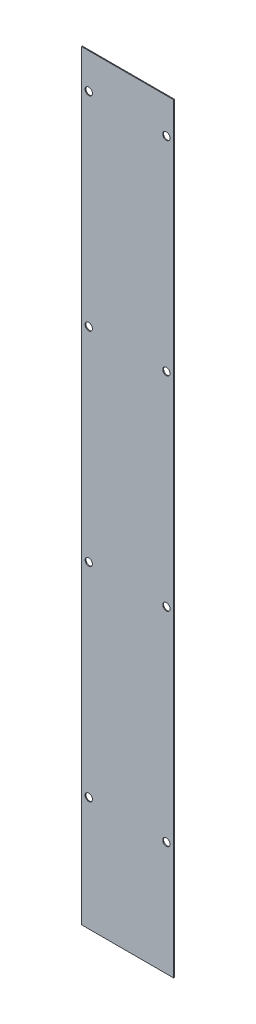
from build123d import *

# Parameters (mm, degrees)
SKETCH1_W          = 76
SKETCH1_H          = 627
BASE_FLANGE1_DEPTH = 0.7
SKETCH2_R          = 3
CUT_EXTRUDE1_DEPTH = 10


# Sheet-metal steps are written as plain solids
with BuildPart() as part:
    # Sketch1 → Base-Flange1 (new body)
    with BuildSketch(Plane.XY):
        with Locations((38, 313.5)):
            Rectangle(SKETCH1_W, SKETCH1_H)
    extrude(amount=-BASE_FLANGE1_DEPTH)

    # Sketch2 → Cut-Extrude1 (cut)
    with BuildSketch(Plane.XY):
        with Locations((70, 598)):
            Circle(SKETCH2_R)
        with Locations((70, 430)):
            Circle(SKETCH2_R)
        with Locations((70, 262)):
            Circle(SKETCH2_R)
        with Locations((70, 94)):
            Circle(SKETCH2_R)
        with Locations((70, -74)):
            Circle(SKETCH2_R)
        with Locations((6, -74)):
            Circle(SKETCH2_R)
        with Locations(Location((6, 94, 0), (0, 0, 180))):
            Circle(SKETCH2_R)
        with Locations(Location((6, 262, 0), (0, 0, 180))):
            Circle(SKETCH2_R)
        with Locations(Location((6, 430, 0), (0, 0, 180))):
            Circle(SKETCH2_R)
        with Locations(Location((6, 598, 0), (0, 0, 180))):
            Circle(SKETCH2_R)
    extrude(amount=-CUT_EXTRUDE1_DEPTH, mode=Mode.SUBTRACT)


solid = part.part
